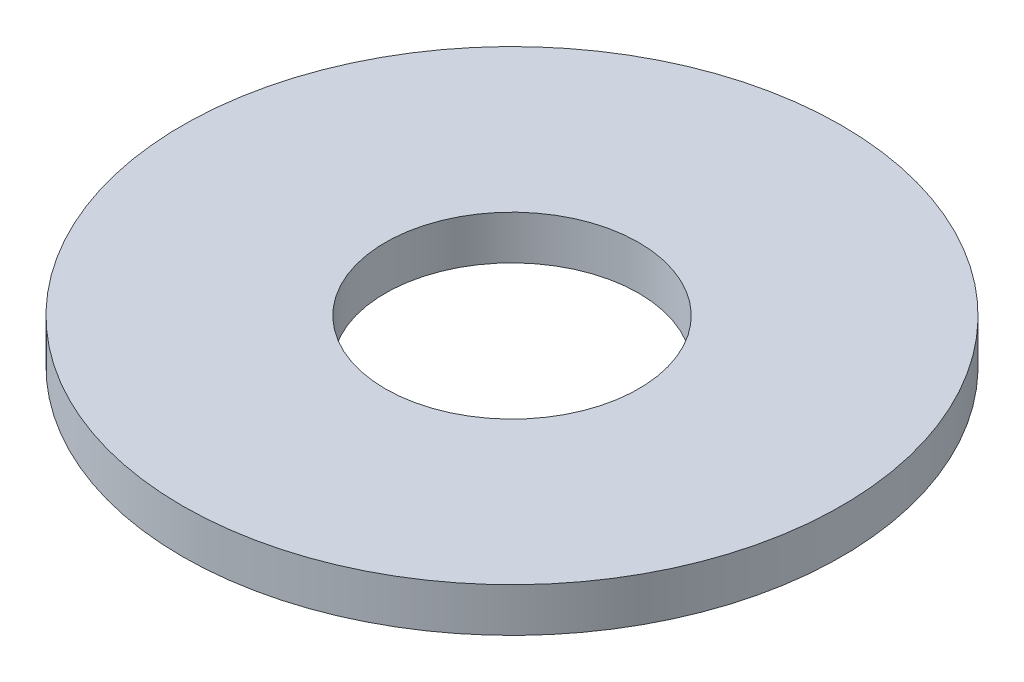
from build123d import *

# Parameters (mm, degrees)
SKETCH1_R           = 97.5
BOSS_EXTRUDE1_DEPTH = 13
SKETCH2_R           = 37.5
CUT_EXTRUDE1_DEPTH  = 139.497292392


with BuildPart() as part:
    # Sketch1 → Boss-Extrude1 (new body)
    with BuildSketch(Plane(origin=(0, 0, 0), x_dir=(1, 0, 0), z_dir=(0, 1, 0))):
        Circle(SKETCH1_R)
    extrude(amount=BOSS_EXTRUDE1_DEPTH)

    # Sketch2 → Cut-Extrude1 (cut, through all)
    with BuildSketch(Plane(origin=(0, 0, 0), x_dir=(1, 0, 0), z_dir=(0, 1, 0))):
        Circle(SKETCH2_R)
    extrude(amount=CUT_EXTRUDE1_DEPTH, mode=Mode.SUBTRACT)


solid = part.part
